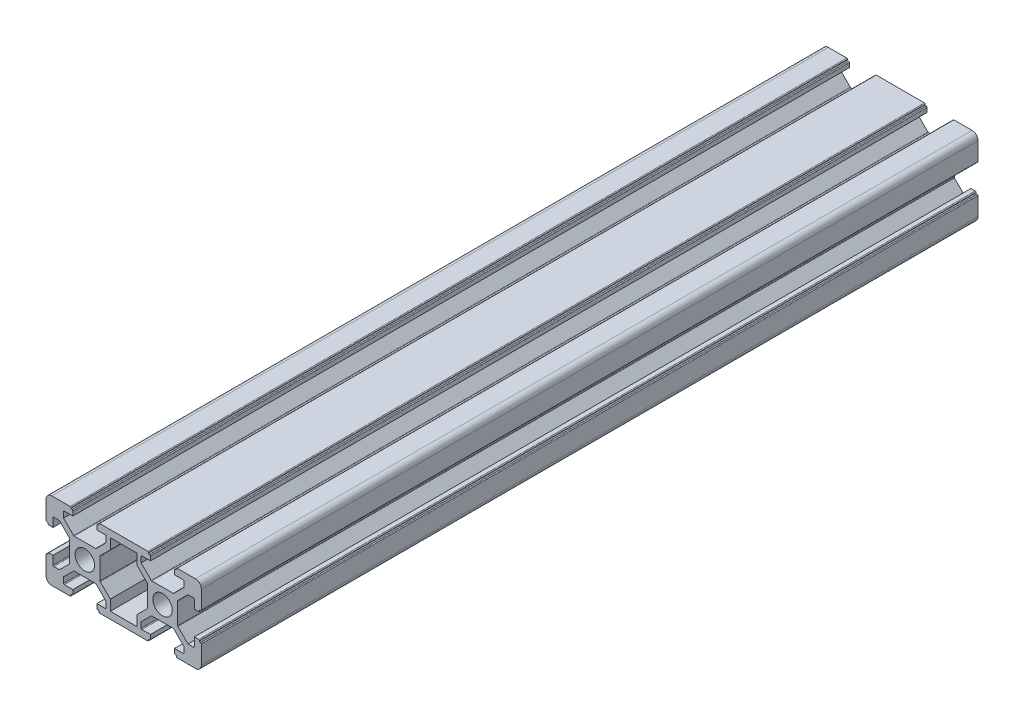
from build123d import *

# Parameters (mm, degrees)
BOSS_EXTRUDE1_DEPTH = 200
SKETCH2_R           = 2.5
CUT_EXTRUDE1_DEPTH  = 203.484567313
SKETCH4_R           = 1.5
CUT_EXTRUDE3_DEPTH  = 30


with BuildPart() as part:
    # Sketch1 → Boss-Extrude1 (new body)
    with BuildSketch(Plane.XY):
        with BuildLine():
            Line((-8.5, 10), (-3.8, 10))
            ThreePointArc((-3.8, 10), (-3.658578644, 9.941421356), (-3.6, 9.8))
            Line((-3.6, 9.8), (-3.6, 9.7))
            ThreePointArc((-3.6, 9.7), (-3.541421356, 9.558578644), (-3.4, 9.5))
            Line((-3.4, 9.5), (-3.3, 9.5))
            ThreePointArc((-3.3, 9.5), (-3.158578644, 9.441421356), (-3.1, 9.3))
            Line((-3.1, 9.3), (-3.1, 8.2))
            Line((-3.1, 8.2), (-5.3, 8.2))
            ThreePointArc((-5.3, 8.2), (-5.441421356, 8.141421356), (-5.5, 8))
            Line((-5.5, 8), (-5.5, 6.560660172))
            Line((-5.5, 6.560660172), (-2.897918472, 3.958578644))
            ThreePointArc((-2.897918472, 3.958578644), (-2.833033802, 3.915224093), (-2.756497116, 3.9))
            Line((-2.756497116, 3.9), (2.756497116, 3.9))
            ThreePointArc((2.756497116, 3.9), (2.833033802, 3.915224093), (2.897918472, 3.958578644))
            Line((2.897918472, 3.958578644), (5.5, 6.560660172))
            Line((5.5, 6.560660172), (5.5, 8))
            ThreePointArc((5.5, 8), (5.441421356, 8.141421356), (5.3, 8.2))
            Line((5.3, 8.2), (3.1, 8.2))
            Line((3.1, 8.2), (3.1, 9.3))
            ThreePointArc((3.1, 9.3), (3.158578644, 9.441421356), (3.3, 9.5))
            Line((3.3, 9.5), (3.4, 9.5))
            ThreePointArc((3.4, 9.5), (3.541421356, 9.558578644), (3.6, 9.7))
            Line((3.6, 9.7), (3.6, 9.8))
            ThreePointArc((3.6, 9.8), (3.658578644, 9.941421356), (3.8, 10))
            Line((3.8, 10), (8.5, 10))
            Line((8.5, 10), (11.5, 10))
            Line((11.5, 10), (16.2, 10))
            ThreePointArc((16.2, 10), (16.341421356, 9.941421356), (16.4, 9.8))
            Line((16.4, 9.8), (16.4, 9.7))
            ThreePointArc((16.4, 9.7), (16.458578644, 9.558578644), (16.6, 9.5))
            Line((16.6, 9.5), (16.7, 9.5))
            ThreePointArc((16.7, 9.5), (16.841421356, 9.441421356), (16.9, 9.3))
            Line((16.9, 9.3), (16.9, 8.2))
            Line((16.9, 8.2), (14.7, 8.2))
            ThreePointArc((14.7, 8.2), (14.558578644, 8.141421356), (14.5, 8))
            Line((14.5, 8), (14.5, 6.560660172))
            Line((14.5, 6.560660172), (17.102081528, 3.958578644))
            ThreePointArc((17.102081528, 3.958578644), (17.166966198, 3.915224093), (17.243502884, 3.9))
            Line((17.243502884, 3.9), (22.756497116, 3.9))
            ThreePointArc((22.756497116, 3.9), (22.833033802, 3.915224093), (22.897918472, 3.958578644))
            Line((22.897918472, 3.958578644), (25.5, 6.560660172))
            Line((25.5, 6.560660172), (25.5, 8))
            ThreePointArc((25.5, 8), (25.441421356, 8.141421356), (25.3, 8.2))
            Line((25.3, 8.2), (23.1, 8.2))
            Line((23.1, 8.2), (23.1, 9.3))
            ThreePointArc((23.1, 9.3), (23.158578644, 9.441421356), (23.3, 9.5))
            Line((23.3, 9.5), (23.4, 9.5))
            ThreePointArc((23.4, 9.5), (23.541421356, 9.558578644), (23.6, 9.7))
            Line((23.6, 9.7), (23.6, 9.8))
            ThreePointArc((23.6, 9.8), (23.658578644, 9.941421356), (23.8, 10))
            Line((23.8, 10), (28.5, 10))
            ThreePointArc((28.5, 10), (29.560660172, 9.560660172), (30, 8.5))
            Line((30, 8.5), (30, 3.8))
            ThreePointArc((30, 3.8), (29.941421356, 3.658578644), (29.8, 3.6))
            Line((29.8, 3.6), (29.7, 3.6))
            ThreePointArc((29.7, 3.6), (29.558578644, 3.541421356), (29.5, 3.4))
            Line((29.5, 3.4), (29.5, 3.3))
            ThreePointArc((29.5, 3.3), (29.441421356, 3.158578644), (29.3, 3.1))
            Line((29.3, 3.1), (28.2, 3.1))
            Line((28.2, 3.1), (28.2, 5.3))
            ThreePointArc((28.2, 5.3), (28.141421356, 5.441421356), (28, 5.5))
            Line((28, 5.5), (26.560660172, 5.5))
            Line((26.560660172, 5.5), (23.958578644, 2.897918472))
            ThreePointArc((23.958578644, 2.897918472), (23.915224093, 2.833033802), (23.9, 2.756497116))
            Line((23.9, 2.756497116), (23.9, -2.756497116))
            ThreePointArc((23.9, -2.756497116), (23.915224093, -2.833033802), (23.958578644, -2.897918472))
            Line((23.958578644, -2.897918472), (26.560660172, -5.5))
            Line((26.560660172, -5.5), (28, -5.5))
            ThreePointArc((28, -5.5), (28.141421356, -5.441421356), (28.2, -5.3))
            Line((28.2, -5.3), (28.2, -3.1))
            Line((28.2, -3.1), (29.3, -3.1))
            ThreePointArc((29.3, -3.1), (29.441421356, -3.158578644), (29.5, -3.3))
            Line((29.5, -3.3), (29.5, -3.4))
            ThreePointArc((29.5, -3.4), (29.558578644, -3.541421356), (29.7, -3.6))
            Line((29.7, -3.6), (29.8, -3.6))
            ThreePointArc((29.8, -3.6), (29.941421356, -3.658578644), (30, -3.8))
            Line((30, -3.8), (30, -8.5))
            ThreePointArc((30, -8.5), (29.560660172, -9.560660172), (28.5, -10))
            Line((28.5, -10), (23.8, -10))
            ThreePointArc((23.8, -10), (23.658578644, -9.941421356), (23.6, -9.8))
            Line((23.6, -9.8), (23.6, -9.7))
            ThreePointArc((23.6, -9.7), (23.541421356, -9.558578644), (23.4, -9.5))
            Line((23.4, -9.5), (23.3, -9.5))
            ThreePointArc((23.3, -9.5), (23.158578644, -9.441421356), (23.1, -9.3))
            Line((23.1, -9.3), (23.1, -8.2))
            Line((23.1, -8.2), (25.3, -8.2))
            ThreePointArc((25.3, -8.2), (25.441421356, -8.141421356), (25.5, -8))
            Line((25.5, -8), (25.5, -6.560660172))
            Line((25.5, -6.560660172), (22.897918472, -3.958578644))
            ThreePointArc((22.897918472, -3.958578644), (22.833033802, -3.915224093), (22.756497116, -3.9))
            Line((22.756497116, -3.9), (17.243502884, -3.9))
            ThreePointArc((17.243502884, -3.9), (17.166966198, -3.915224093), (17.102081528, -3.958578644))
            Line((17.102081528, -3.958578644), (14.5, -6.560660172))
            Line((14.5, -6.560660172), (14.5, -8))
            ThreePointArc((14.5, -8), (14.558578644, -8.141421356), (14.7, -8.2))
            Line((14.7, -8.2), (16.9, -8.2))
            Line((16.9, -8.2), (16.9, -9.3))
            ThreePointArc((16.9, -9.3), (16.841421356, -9.441421356), (16.7, -9.5))
            Line((16.7, -9.5), (16.6, -9.5))
            ThreePointArc((16.6, -9.5), (16.458578644, -9.558578644), (16.4, -9.7))
            Line((16.4, -9.7), (16.4, -9.8))
            ThreePointArc((16.4, -9.8), (16.341421356, -9.941421356), (16.2, -10))
            Line((16.2, -10), (11.5, -10))
            Line((11.5, -10), (8.5, -10))
            Line((8.5, -10), (3.8, -10))
            ThreePointArc((3.8, -10), (3.658578644, -9.941421356), (3.6, -9.8))
            Line((3.6, -9.8), (3.6, -9.7))
            ThreePointArc((3.6, -9.7), (3.541421356, -9.558578644), (3.4, -9.5))
            Line((3.4, -9.5), (3.3, -9.5))
            ThreePointArc((3.3, -9.5), (3.158578644, -9.441421356), (3.1, -9.3))
            Line((3.1, -9.3), (3.1, -8.2))
            Line((3.1, -8.2), (5.3, -8.2))
            ThreePointArc((5.3, -8.2), (5.441421356, -8.141421356), (5.5, -8))
            Line((5.5, -8), (5.5, -6.560660172))
            Line((5.5, -6.560660172), (2.897918472, -3.958578644))
            ThreePointArc((2.897918472, -3.958578644), (2.833033802, -3.915224093), (2.756497116, -3.9))
            Line((2.756497116, -3.9), (-2.756497116, -3.9))
            ThreePointArc((-2.756497116, -3.9), (-2.833033802, -3.915224093), (-2.897918472, -3.958578644))
            Line((-2.897918472, -3.958578644), (-5.5, -6.560660172))
            Line((-5.5, -6.560660172), (-5.5, -8))
            ThreePointArc((-5.5, -8), (-5.441421356, -8.141421356), (-5.3, -8.2))
            Line((-5.3, -8.2), (-3.1, -8.2))
            Line((-3.1, -8.2), (-3.1, -9.3))
            ThreePointArc((-3.1, -9.3), (-3.158578644, -9.441421356), (-3.3, -9.5))
            Line((-3.3, -9.5), (-3.4, -9.5))
            ThreePointArc((-3.4, -9.5), (-3.541421356, -9.558578644), (-3.6, -9.7))
            Line((-3.6, -9.7), (-3.6, -9.8))
            ThreePointArc((-3.6, -9.8), (-3.658578644, -9.941421356), (-3.8, -10))
            Line((-3.8, -10), (-8.5, -10))
            ThreePointArc((-8.5, -10), (-9.560660172, -9.560660172), (-10, -8.5))
            Line((-10, -8.5), (-10, -3.8))
            ThreePointArc((-10, -3.8), (-9.941421356, -3.658578644), (-9.8, -3.6))
            Line((-9.8, -3.6), (-9.7, -3.6))
            ThreePointArc((-9.7, -3.6), (-9.558578644, -3.541421356), (-9.5, -3.4))
            Line((-9.5, -3.4), (-9.5, -3.3))
            ThreePointArc((-9.5, -3.3), (-9.441421356, -3.158578644), (-9.3, -3.1))
            Line((-9.3, -3.1), (-8.2, -3.1))
            Line((-8.2, -3.1), (-8.2, -5.3))
            ThreePointArc((-8.2, -5.3), (-8.141421356, -5.441421356), (-8, -5.5))
            Line((-8, -5.5), (-6.560660172, -5.5))
            Line((-6.560660172, -5.5), (-3.958578644, -2.897918472))
            ThreePointArc((-3.958578644, -2.897918472), (-3.915224093, -2.833033802), (-3.9, -2.756497116))
            Line((-3.9, -2.756497116), (-3.9, 2.756497116))
            ThreePointArc((-3.9, 2.756497116), (-3.915224093, 2.833033802), (-3.958578644, 2.897918472))
            Line((-3.958578644, 2.897918472), (-6.560660172, 5.5))
            Line((-6.560660172, 5.5), (-8, 5.5))
            ThreePointArc((-8, 5.5), (-8.141421356, 5.441421356), (-8.2, 5.3))
            Line((-8.2, 5.3), (-8.2, 3.1))
            Line((-8.2, 3.1), (-9.3, 3.1))
            ThreePointArc((-9.3, 3.1), (-9.441421356, 3.158578644), (-9.5, 3.3))
            Line((-9.5, 3.3), (-9.5, 3.4))
            ThreePointArc((-9.5, 3.4), (-9.558578644, 3.541421356), (-9.7, 3.6))
            Line((-9.7, 3.6), (-9.8, 3.6))
            ThreePointArc((-9.8, 3.6), (-9.941421356, 3.658578644), (-10, 3.8))
            Line((-10, 3.8), (-10, 8.5))
            ThreePointArc((-10, 8.5), (-9.560660172, 9.560660172), (-8.5, 10))
        make_face()
        with BuildLine():
            Line((3.9, 2.756497116), (3.9, -2.756497116))
            ThreePointArc((3.9, -2.756497116), (3.915224093, -2.833033802), (3.958578644, -2.897918472))
            Line((3.958578644, -2.897918472), (6.560660172, -5.5))
            Line((6.560660172, -5.5), (6.560660172, -8.2))
            Line((6.560660172, -8.2), (13.439339828, -8.2))
            Line((13.439339828, -8.2), (13.439339828, -5.5))
            Line((13.439339828, -5.5), (16.041421356, -2.897918472))
            ThreePointArc((16.041421356, -2.897918472), (16.084775907, -2.833033802), (16.1, -2.756497116))
            Line((16.1, -2.756497116), (16.1, 2.756497116))
            ThreePointArc((16.1, 2.756497116), (16.084775907, 2.833033802), (16.041421356, 2.897918472))
            Line((16.041421356, 2.897918472), (13.439339828, 5.5))
            Line((13.439339828, 5.5), (13.439339828, 8.2))
            Line((13.439339828, 8.2), (6.560660172, 8.2))
            Line((6.560660172, 8.2), (6.560660172, 5.5))
            Line((6.560660172, 5.5), (3.958578644, 2.897918472))
            ThreePointArc((3.958578644, 2.897918472), (3.915224093, 2.833033802), (3.9, 2.756497116))
        make_face(mode=Mode.SUBTRACT)
    extrude(amount=BOSS_EXTRUDE1_DEPTH)

    # Sketch2 → Cut-Extrude1 (cut, through all)
    with BuildSketch(Plane.XY.offset(200)):
        Circle(SKETCH2_R)
        with Locations((20, 0)):
            Circle(SKETCH2_R)
    extrude(amount=-CUT_EXTRUDE1_DEPTH, mode=Mode.SUBTRACT)

    # Sketch4 → Cut-Extrude3 (cut)
    with BuildSketch(Plane(origin=(0, 3.9, 0), x_dir=(1, 0, 0), z_dir=(0, 1, 0))):
        with Locations((0, -183.3)):
            Circle(SKETCH4_R)
        with Locations((0, -166.6)):
            Circle(SKETCH4_R)
        with Locations((20, -166.6)):
            Circle(SKETCH4_R)
        with Locations((20, -183.3)):
            Circle(SKETCH4_R)
    extrude(amount=-CUT_EXTRUDE3_DEPTH, mode=Mode.SUBTRACT)


solid = part.part
